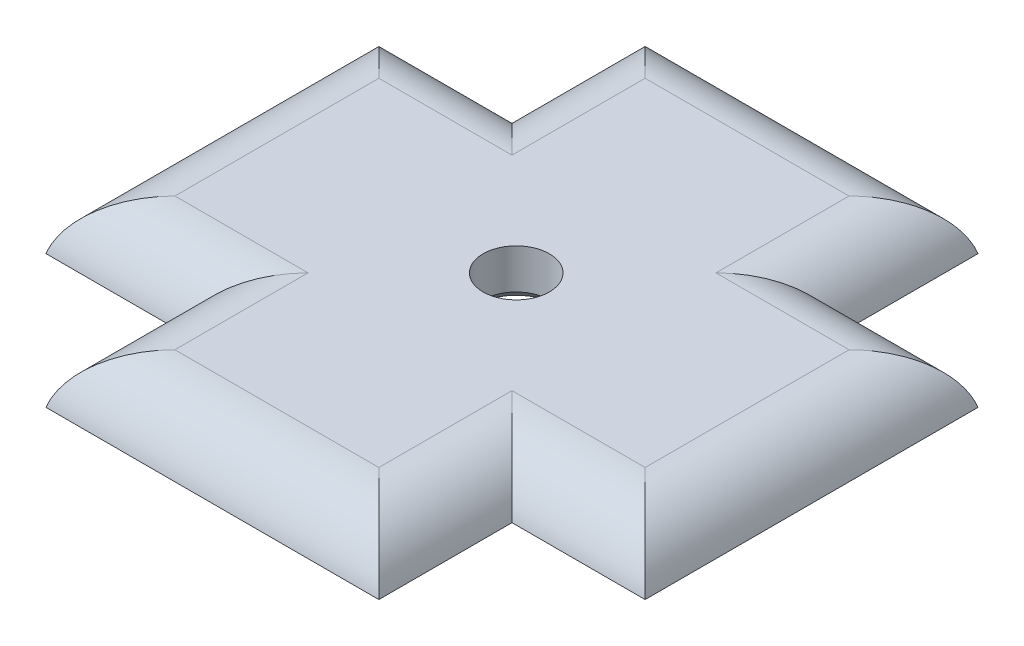
from build123d import *

# Parameters (mm, degrees)
BOSS_EXTRUDE1_DEPTH = 7.5
FILLET1_R           = 10
SKETCH2_R           = 4.975
CUT_EXTRUDE1_DEPTH  = 7.5
CHAMFER1_SIZE       = 1.5


with BuildPart() as part:
    # Sketch1 → Boss-Extrude1 (new body)
    with BuildSketch(Plane(origin=(0, 0, 0), x_dir=(1, 0, 0), z_dir=(0, 1, 0))):
        Polygon((70, 0), (20, 0), (20, -20), (0, -20), (0, -70), (20, -70), (20, -90), (70, -90), (70, -70), (90, -70), (90, -20), (70, -20), align=None)
    extrude(amount=BOSS_EXTRUDE1_DEPTH)

    # Fillet1
    # the kernel refuses this fillet: 10 mm, written as the material it takes off along each edge
    with BuildSketch(Plane(origin=(-24.206145914, 7.5, 70), x_dir=(0, -1, 0), z_dir=(1, 0, 0)), Plane(origin=(20, 7.5, 70), x_dir=(0, -1, 0), z_dir=(0, 0, 1)), Plane(origin=(70, 7.5, 114.206145914), x_dir=(0, -1, 0), z_dir=(0, 0, -1)), Plane(origin=(70, 7.5, 70), x_dir=(0, -1, 0), z_dir=(1, 0, 0)), Plane(origin=(114.206145914, 7.5, 20), x_dir=(0, -1, 0), z_dir=(-1, 0, 0)), Plane(origin=(70, 7.5, 20), x_dir=(0, -1, 0), z_dir=(0, 0, -1)), Plane(origin=(20, 7.5, -24.206145914), x_dir=(0, -1, 0), z_dir=(0, 0, 1)), Plane(origin=(20, 7.5, 20), x_dir=(0, -1, 0), z_dir=(-1, 0, 0))) as fillet1_piece_1:
        with BuildLine():
            CenterArc((10, 9.682458366), FILLET1_R, 180, 75.522487814)
            Line((0, 9.682458366), (-0.2, 9.682458366))
            Line((-0.2, 9.682458366), (-0.2, 0))
            Line((-0.2, 0), (0, -0.2))
            ThreePointArc((0, -0.2), (3.75, -0.2), (7.45, -0.193649167))
            Line((7.45, -0.193649167), (7.5, 0))
        make_face()
    extrude(amount=44.206145914, mode=Mode.SUBTRACT)
    with BuildSketch(Plane(origin=(-4.206145914, 7.5, 90), x_dir=(0, -1, 0), z_dir=(1, 0, 0)), Plane(origin=(90, 7.5, 94.206145914), x_dir=(0, -1, 0), z_dir=(0, 0, -1)), Plane(origin=(94.206145914, 7.5, 0), x_dir=(0, -1, 0), z_dir=(-1, 0, 0)), Plane(origin=(0, 7.5, -4.206145914), x_dir=(0, -1, 0), z_dir=(0, 0, 1))) as fillet1_piece_2:
        with BuildLine():
            CenterArc((10, 9.682458366), FILLET1_R, 180, 75.522487814)
            Line((0, 9.682458366), (-0.2, 9.682458366))
            Line((-0.2, 9.682458366), (-0.2, 0))
            Line((-0.2, 0), (0, -0.2))
            ThreePointArc((0, -0.2), (3.75, -0.2), (7.45, -0.193649167))
            Line((7.45, -0.193649167), (7.5, 0))
        make_face()
    extrude(amount=98.412291828, mode=Mode.SUBTRACT)
    with BuildSketch(Plane(origin=(-24.206145914, 7.5, 70), x_dir=(0, -1, 0), z_dir=(1, 0, 0))) as fillet1_piece_3a_section:
        with BuildLine():
            CenterArc((10, 9.682458366), FILLET1_R, 180, 75.522487814)
            Line((0, 9.682458366), (-0.2, 9.682458366))
            Line((-0.2, 9.682458366), (-0.2, 0))
            Line((-0.2, 0), (0, -0.2))
            ThreePointArc((0, -0.2), (3.75, -0.2), (7.45, -0.193649167))
            Line((7.45, -0.193649167), (7.5, 0))
        make_face()
    fillet1_piece_3a = extrude(amount=68.412291828, mode=Mode.PRIVATE)
    fillet1_piece_3a = split(fillet1_piece_3a, bisect_by=Plane(origin=(20, 5.604082443, 67.718558992), z_dir=(1, 0, 0)), keep=Keep.TOP, mode=Mode.PRIVATE)
    with BuildSketch(Plane(origin=(20, 7.5, 45.793854086), x_dir=(0, -1, 0), z_dir=(0, 0, 1))) as fillet1_piece_3b_section:
        with BuildLine():
            CenterArc((10, 9.682458366), FILLET1_R, 180, 75.522487814)
            Line((0, 9.682458366), (-0.2, 9.682458366))
            Line((-0.2, 9.682458366), (-0.2, 0))
            Line((-0.2, 0), (0, -0.2))
            ThreePointArc((0, -0.2), (3.75, -0.2), (7.45, -0.193649167))
            Line((7.45, -0.193649167), (7.5, 0))
        make_face()
    fillet1_piece_3b = extrude(amount=68.412291828, mode=Mode.PRIVATE)
    fillet1_piece_3b = split(fillet1_piece_3b, bisect_by=Plane(origin=(22.281441008, 5.604082443, 70), z_dir=(0, 0, -1)), keep=Keep.TOP, mode=Mode.PRIVATE)
    fillet1_piece_3 = fillet1_piece_3a & fillet1_piece_3b
    add(fillet1_piece_3, mode=Mode.SUBTRACT)
    with BuildSketch(Plane(origin=(70, 7.5, 114.206145914), x_dir=(0, -1, 0), z_dir=(0, 0, -1))) as fillet1_piece_4a_section:
        with BuildLine():
            CenterArc((10, 9.682458366), FILLET1_R, 180, 75.522487814)
            Line((0, 9.682458366), (-0.2, 9.682458366))
            Line((-0.2, 9.682458366), (-0.2, 0))
            Line((-0.2, 0), (0, -0.2))
            ThreePointArc((0, -0.2), (3.75, -0.2), (7.45, -0.193649167))
            Line((7.45, -0.193649167), (7.5, 0))
        make_face()
    fillet1_piece_4a = extrude(amount=68.412291828, mode=Mode.PRIVATE)
    fillet1_piece_4a = split(fillet1_piece_4a, bisect_by=Plane(origin=(67.718558992, 5.604082443, 70), z_dir=(0, 0, -1)), keep=Keep.TOP, mode=Mode.PRIVATE)
    with BuildSketch(Plane(origin=(45.793854086, 7.5, 70), x_dir=(0, -1, 0), z_dir=(1, 0, 0))) as fillet1_piece_4b_section:
        with BuildLine():
            CenterArc((10, 9.682458366), FILLET1_R, 180, 75.522487814)
            Line((0, 9.682458366), (-0.2, 9.682458366))
            Line((-0.2, 9.682458366), (-0.2, 0))
            Line((-0.2, 0), (0, -0.2))
            ThreePointArc((0, -0.2), (3.75, -0.2), (7.45, -0.193649167))
            Line((7.45, -0.193649167), (7.5, 0))
        make_face()
    fillet1_piece_4b = extrude(amount=68.412291828, mode=Mode.PRIVATE)
    fillet1_piece_4b = split(fillet1_piece_4b, bisect_by=Plane(origin=(70, 5.604082443, 67.718558992), z_dir=(-1, 0, 0)), keep=Keep.TOP, mode=Mode.PRIVATE)
    fillet1_piece_4 = fillet1_piece_4a & fillet1_piece_4b
    add(fillet1_piece_4, mode=Mode.SUBTRACT)
    with BuildSketch(Plane(origin=(114.206145914, 7.5, 20), x_dir=(0, -1, 0), z_dir=(-1, 0, 0))) as fillet1_piece_5a_section:
        with BuildLine():
            CenterArc((10, 9.682458366), FILLET1_R, 180, 75.522487814)
            Line((0, 9.682458366), (-0.2, 9.682458366))
            Line((-0.2, 9.682458366), (-0.2, 0))
            Line((-0.2, 0), (0, -0.2))
            ThreePointArc((0, -0.2), (3.75, -0.2), (7.45, -0.193649167))
            Line((7.45, -0.193649167), (7.5, 0))
        make_face()
    fillet1_piece_5a = extrude(amount=68.412291828, mode=Mode.PRIVATE)
    fillet1_piece_5a = split(fillet1_piece_5a, bisect_by=Plane(origin=(70, 5.604082443, 22.281441008), z_dir=(-1, 0, 0)), keep=Keep.TOP, mode=Mode.PRIVATE)
    with BuildSketch(Plane(origin=(70, 7.5, 44.206145914), x_dir=(0, -1, 0), z_dir=(0, 0, -1))) as fillet1_piece_5b_section:
        with BuildLine():
            CenterArc((10, 9.682458366), FILLET1_R, 180, 75.522487814)
            Line((0, 9.682458366), (-0.2, 9.682458366))
            Line((-0.2, 9.682458366), (-0.2, 0))
            Line((-0.2, 0), (0, -0.2))
            ThreePointArc((0, -0.2), (3.75, -0.2), (7.45, -0.193649167))
            Line((7.45, -0.193649167), (7.5, 0))
        make_face()
    fillet1_piece_5b = extrude(amount=68.412291828, mode=Mode.PRIVATE)
    fillet1_piece_5b = split(fillet1_piece_5b, bisect_by=Plane(origin=(67.718558992, 5.604082443, 20), z_dir=(0, 0, 1)), keep=Keep.TOP, mode=Mode.PRIVATE)
    fillet1_piece_5 = fillet1_piece_5a & fillet1_piece_5b
    add(fillet1_piece_5, mode=Mode.SUBTRACT)
    with BuildSketch(Plane(origin=(20, 7.5, -24.206145914), x_dir=(0, -1, 0), z_dir=(0, 0, 1))) as fillet1_piece_6a_section:
        with BuildLine():
            CenterArc((10, 9.682458366), FILLET1_R, 180, 75.522487814)
            Line((0, 9.682458366), (-0.2, 9.682458366))
            Line((-0.2, 9.682458366), (-0.2, 0))
            Line((-0.2, 0), (0, -0.2))
            ThreePointArc((0, -0.2), (3.75, -0.2), (7.45, -0.193649167))
            Line((7.45, -0.193649167), (7.5, 0))
        make_face()
    fillet1_piece_6a = extrude(amount=68.412291828, mode=Mode.PRIVATE)
    fillet1_piece_6a = split(fillet1_piece_6a, bisect_by=Plane(origin=(22.281441008, 5.604082443, 20), z_dir=(0, 0, 1)), keep=Keep.TOP, mode=Mode.PRIVATE)
    with BuildSketch(Plane(origin=(44.206145914, 7.5, 20), x_dir=(0, -1, 0), z_dir=(-1, 0, 0))) as fillet1_piece_6b_section:
        with BuildLine():
            CenterArc((10, 9.682458366), FILLET1_R, 180, 75.522487814)
            Line((0, 9.682458366), (-0.2, 9.682458366))
            Line((-0.2, 9.682458366), (-0.2, 0))
            Line((-0.2, 0), (0, -0.2))
            ThreePointArc((0, -0.2), (3.75, -0.2), (7.45, -0.193649167))
            Line((7.45, -0.193649167), (7.5, 0))
        make_face()
    fillet1_piece_6b = extrude(amount=68.412291828, mode=Mode.PRIVATE)
    fillet1_piece_6b = split(fillet1_piece_6b, bisect_by=Plane(origin=(20, 5.604082443, 22.281441008), z_dir=(1, 0, 0)), keep=Keep.TOP, mode=Mode.PRIVATE)
    fillet1_piece_6 = fillet1_piece_6a & fillet1_piece_6b
    add(fillet1_piece_6, mode=Mode.SUBTRACT)

    # Sketch2 → Cut-Extrude1 (cut)
    with BuildSketch(Plane(origin=(0, 7.5, 0), x_dir=(1, 0, 0), z_dir=(0, 1, 0))):
        with Locations(Location((45.317541634, -44.682458366, 0), (0, 0, 270))):
            Circle(SKETCH2_R)
    extrude(amount=-CUT_EXTRUDE1_DEPTH, mode=Mode.SUBTRACT)

    # Chamfer1
    chamfer1_edges = [part.edges().sort_by_distance(p)[0] for p in [
        (45.317541634, 0, 39.707458366),
    ]]
    chamfer(chamfer1_edges, length=CHAMFER1_SIZE)


solid = part.part
